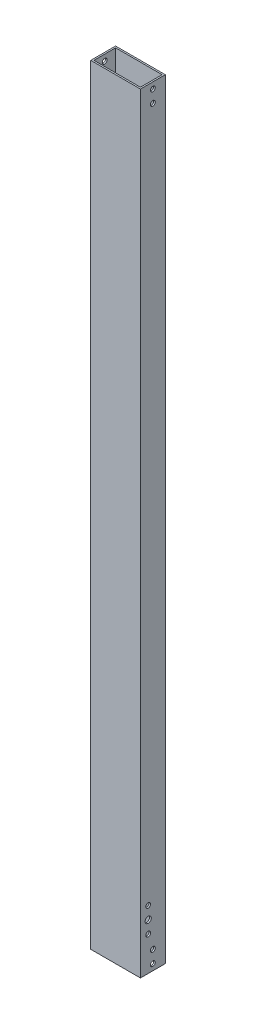
from build123d import *

# Parameters (mm, degrees)
SKETCH1_W               = 50.8
SKETCH1_H               = 787.4
BOSS_EXTRUDE1_DEPTH     = 12.7
SHELL1_T                = -1.5875
SKETCH3_R               = 2.4892
CUT_EXTRUDE1_DEPTH      = 395.722864805
CUT_EXTRUDE2_DEPTH      = 395.722864805
CUT_EXTRUDE2_DEPTH_BACK = 395.722864805
SKETCH4_R               = 3.175
SKETCH4_R_2             = 2.4892


with BuildPart() as part:
    # Sketch1 → Boss-Extrude1 (new, symmetric)
    with BuildSketch(Plane.XY):
        Rectangle(SKETCH1_W, SKETCH1_H)
    extrude(amount=BOSS_EXTRUDE1_DEPTH, both=True)

    # Shell1
    shell1_openings = [part.faces().sort_by_distance(p)[0] for p in [
        (0, -393.7, 0),
        (0, 393.7, 0),
    ]]
    offset(amount=SHELL1_T, openings=shell1_openings, kind=Kind.INTERSECTION)

    # Sketch3 → Cut-Extrude1 (cut, symmetric)
    with BuildSketch(Plane(origin=(0, 0, 0), x_dir=(0, 0, -1), z_dir=(1, 0, 0))):
        with Locations((0, -387.35)):
            Circle(SKETCH3_R)
        with Locations((0, -374.65)):
            Circle(SKETCH3_R)
    cut_extrude1 = extrude(amount=CUT_EXTRUDE1_DEPTH, both=True, mode=Mode.SUBTRACT)

    # Sketch4 → Cut-Extrude2 (cut, two sides: drawn at the far end of the back side and taken through both)
    with BuildSketch(Plane(origin=(0, 0, 0), x_dir=(0, 0, -1), z_dir=(1, 0, 0)).offset(-CUT_EXTRUDE2_DEPTH_BACK)):
        with Locations((-4.7625, -346.075)):
            Circle(SKETCH4_R)
        with Locations((-4.7625, -333.375)):
            Circle(SKETCH4_R_2)
        with Locations((-4.7625, -358.775)):
            Circle(SKETCH4_R_2)
    extrude(amount=CUT_EXTRUDE2_DEPTH + CUT_EXTRUDE2_DEPTH_BACK, mode=Mode.SUBTRACT)

    # Mirror1: Cut-Extrude1 across plane
    add(cut_extrude1.mirror(Plane.ZX), mode=Mode.SUBTRACT)


solid = part.part
